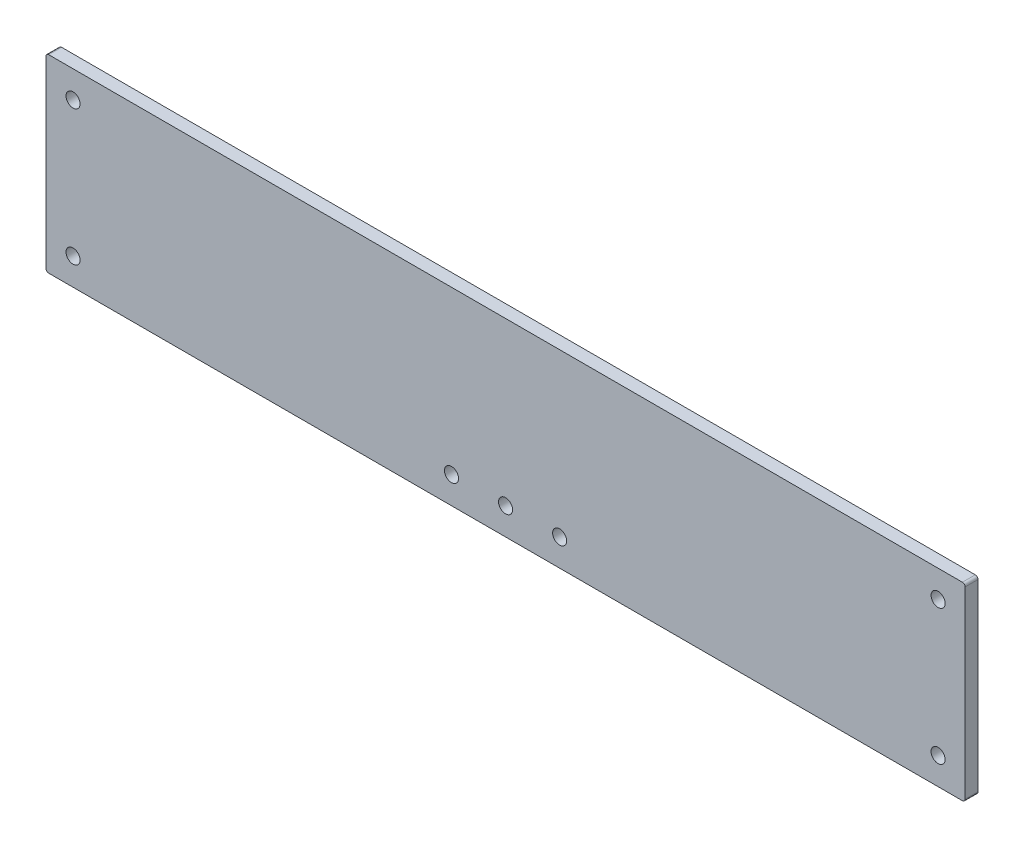
from build123d import *

# Parameters (mm, degrees)
BASE_FLANGE1_DEPTH         = 4.7625
F_5_2_5_2_DIAMETER_HOLE1_D = 5.2


# Sheet-metal steps are written as plain solids
with BuildPart() as part:
    # Sketch11 → Base-Flange1 (new body)
    with BuildSketch(Plane.XY.offset(4.7625)):
        with BuildLine():
            Line((0, 69), (0, 1))
            ThreePointArc((0, 1), (0.292893219, 0.292893219), (1, 0))
            Line((1, 0), (339, 0))
            ThreePointArc((339, 0), (339.707106781, 0.292893219), (340, 1))
            Line((340, 1), (340, 69))
            ThreePointArc((340, 69), (339.707106781, 69.707106781), (339, 70))
            Line((339, 70), (1, 70))
            ThreePointArc((1, 70), (0.292893219, 69.707106781), (0, 69))
        make_face()
    extrude(amount=-BASE_FLANGE1_DEPTH)

    # Ø5.2 (5.2) Diameter Hole1 (through all)
    with Locations(Plane.XY.offset(4.7625)):
        with Locations((190, 10), (170, 10), (330, 60), (10, 10), (10, 60), (330, 10), (150, 10)):
            Hole(F_5_2_5_2_DIAMETER_HOLE1_D / 2)


solid = part.part
